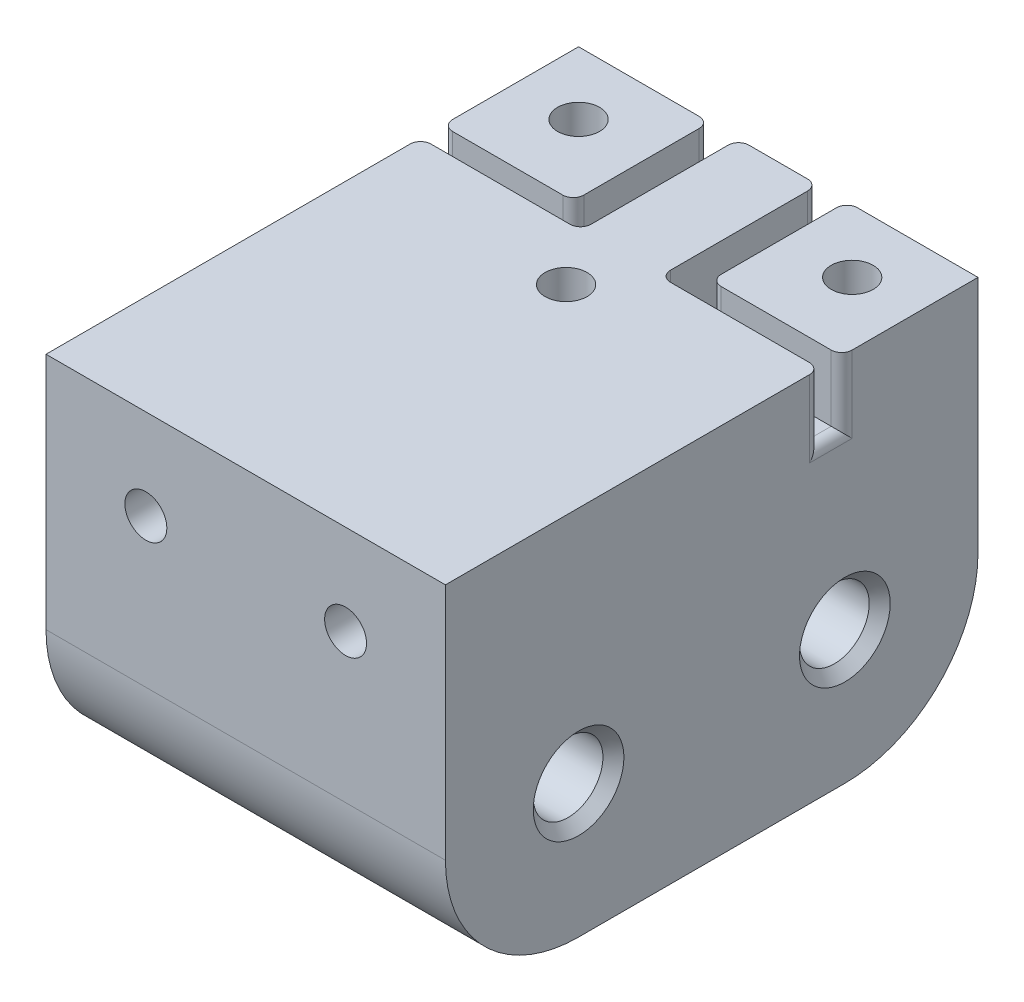
from build123d import *

# Parameters (mm, degrees)
SKETCH1_R           = 3.325
BOSS_EXTRUDE2_DEPTH = 38.1
CUT_EXTRUDE5_REACH  = 74.725
SKETCH6_R           = 2
BOSS_EXTRUDE3_REACH = 74.725
SKETCH10_R          = 2
CUT_EXTRUDE6_DEPTH  = 8
CHAMFER1_SIZE       = 1
CUT_EXTRUDE9_DEPTH  = 6.3
FILLET3_R           = 1
SKETCH16_R          = 2
CUT_EXTRUDE10_DEPTH = 5


with BuildPart() as part:
    # Sketch1 → Boss-Extrude2 (new body)
    with BuildSketch(Plane(origin=(0, 0, 0), x_dir=(0, 0, -1), z_dir=(1, 0, 0))):
        with BuildLine():
            Line((50.8, 22.75), (0, 22.75))
            Line((0, 22.75), (0, 0))
            ThreePointArc((0, 0), (12.7, -12.7), (25.4, 0))
            ThreePointArc((25.4, 0), (38.1, -12.7), (50.8, 0))
            Line((50.8, 0), (50.8, 22.75))
        make_face()
        with Locations((38.1, 0)):
            Circle(SKETCH1_R, mode=Mode.SUBTRACT)
        with Locations((12.7, 0)):
            Circle(SKETCH1_R, mode=Mode.SUBTRACT)
    extrude(amount=BOSS_EXTRUDE2_DEPTH)

    # Sketch6 → Cut-Extrude5 (cut, up to next)
    with BuildSketch(Plane(origin=(0, -12.7, 0), x_dir=(-1, 0, 0), z_dir=(0, -1, 0)), mode=Mode.PRIVATE) as cut_extrude5_sk1:
        with Locations((-19.05, 38.1)):
            Circle(SKETCH6_R)
    cut_extrude5_tool1 = extrude(cut_extrude5_sk1.sketch, amount=-CUT_EXTRUDE5_REACH, mode=Mode.PRIVATE) & part.part
    # Sketch6 → Cut-Extrude5 (cut, up to next)
    with BuildSketch(Plane(origin=(0, -12.7, 0), x_dir=(-1, 0, 0), z_dir=(0, -1, 0)), mode=Mode.PRIVATE) as cut_extrude5_sk2:
        with Locations((-19.05, 12.7)):
            Circle(SKETCH6_R)
    cut_extrude5_tool2 = extrude(cut_extrude5_sk2.sketch, amount=-CUT_EXTRUDE5_REACH, mode=Mode.PRIVATE) & part.part
    add(cut_extrude5_tool1.solids().sort_by_distance((19.05, -12.7, -38.1))[0], mode=Mode.SUBTRACT)
    add(cut_extrude5_tool2.solids().sort_by_distance((19.05, -12.7, -12.7))[0], mode=Mode.SUBTRACT)

    # Sketch6<3> → Boss-Extrude3 (add, up to next)
    with BuildSketch(Plane(origin=(0, -12.7, 0), x_dir=(-1, 0, 0), z_dir=(0, -1, 0)), mode=Mode.PRIVATE) as boss_extrude3_sk1:
        with BuildLine():
            Line((0, 38.1), (-17.05, 38.1))
            ThreePointArc((-17.05, 38.1), (-19.05, 36.1), (-21.05, 38.1))
            Line((-21.05, 38.1), (-38.1, 38.1))
            Line((-38.1, 38.1), (-38.1, 12.7))
            Line((-38.1, 12.7), (-21.05, 12.7))
            ThreePointArc((-21.05, 12.7), (-19.05, 14.7), (-17.05, 12.7))
            Line((-17.05, 12.7), (0, 12.7))
            Line((0, 12.7), (0, 38.1))
        make_face()
    boss_extrude3_tool1 = extrude(boss_extrude3_sk1.sketch, amount=-BOSS_EXTRUDE3_REACH, mode=Mode.PRIVATE) - part.part
    add(boss_extrude3_tool1.solids().sort_by_distance((19.05, -12.7, -25.4))[0])

    # Sketch10 → Cut-Extrude6 (cut)
    with BuildSketch(Plane.XY):
        with Locations((9.525, 14.153125)):
            Circle(SKETCH10_R)
        with Locations((28.575, 14.153125)):
            Circle(SKETCH10_R)
    extrude(amount=-CUT_EXTRUDE6_DEPTH, mode=Mode.SUBTRACT)

    # Chamfer1
    chamfer1_edges = [part.edges().sort_by_distance(p)[0] for p in [
        (38.1, 0, -9.375),
        (38.1, 0, -34.775),
        (0, 0, -9.375),
        (0, 0, -34.775),
    ]]
    chamfer(chamfer1_edges, length=CHAMFER1_SIZE)

    # Sketch15 → Cut-Extrude9 (cut)
    with BuildSketch(Plane(origin=(0, 22.75, 0), x_dir=(1, 0, 0), z_dir=(0, 1, 0))):
        Polygon((12.5, 37.795), (0, 37.795), (0, 35.725), (15.26, 35.725), (15.26, 50.8), (12.5, 50.8), align=None)
        Polygon((25.6, 50.8), (22.84, 50.8), (22.84, 35.725), (38.1, 35.725), (38.1, 37.795), (25.6, 37.795), align=None)
    extrude(amount=-CUT_EXTRUDE9_DEPTH, mode=Mode.SUBTRACT)

    # Fillet3
    fillet3_edges = [part.edges().sort_by_distance(p)[0] for p in [
        (25.6, 19.6, -37.795),
        (22.84, 19.6, -35.725),
        (15.26, 19.6, -35.725),
        (12.5, 19.6, -37.795),
        (38.1, 19.6, -35.725),
        (38.1, 16.45, -36.76),
        (38.1, 19.6, -37.795),
        (25.6, 19.6, -50.8),
        (24.22, 16.45, -50.8),
        (22.84, 19.6, -50.8),
        (15.26, 19.6, -50.8),
        (13.88, 16.45, -50.8),
        (12.5, 19.6, -50.8),
        (0, 19.6, -37.795),
        (0, 16.45, -36.76),
        (0, 19.6, -35.725),
    ]]
    fillet(fillet3_edges, radius=FILLET3_R)

    # Sketch16 → Cut-Extrude10 (cut)
    with BuildSketch(Plane(origin=(0, 22.75, 0), x_dir=(1, 0, 0), z_dir=(0, 1, 0))):
        with Locations((19.05, 30.56)):
            Circle(SKETCH16_R)
        with Locations((6, 44.8)):
            Circle(SKETCH16_R)
        with Locations((32.1, 44.8)):
            Circle(SKETCH16_R)
    extrude(amount=-CUT_EXTRUDE10_DEPTH, mode=Mode.SUBTRACT)


solid = part.part
